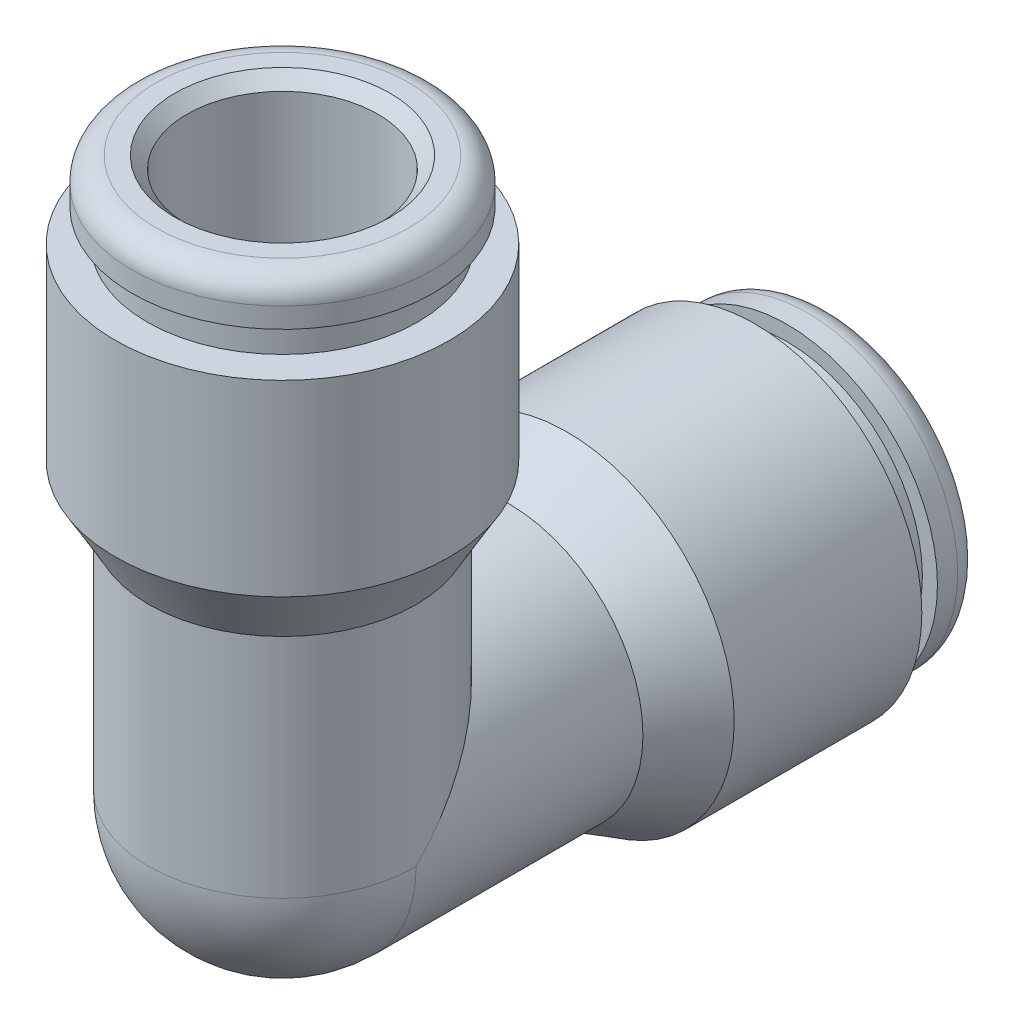
from build123d import *

# Parameters (mm, degrees)
CIRPATTERN1_COUNT = 2
CIRPATTERN1_ANGLE = 90
REVOLVE2_ANGLE    = 90
CIRPATTERN2_COUNT = 2
CIRPATTERN2_ANGLE = 90


with BuildPart() as part:
    # Sketch1 → Revolve1 (revolve)
    with BuildSketch(Plane(origin=(0, 0, 0), x_dir=(0, 0, -1), z_dir=(1, 0, 0))):
        with BuildLine():
            Line((15.853, 4.725), (16.488, 4.725))
            ThreePointArc((16.488, 4.725), (17.026815367, 4.501815367), (17.25, 3.963))
            Line((17.25, 3.963), (17.25, 3.381))
            Line((17.25, 3.381), (16.869, 3))
            Line((16.869, 3), (6, 3))
            Line((6, 3), (6, 2.238))
            Line((6, 2.238), (0, 2.238))
            Line((0, 2.238), (0, 4.2))
            Line((0, 4.2), (7.125, 4.2))
            Line((7.125, 4.2), (8.943653348, 5.25))
            Line((8.943653348, 5.25), (14.837, 5.25))
            Line((14.837, 5.25), (14.837, 4.2525))
            Line((14.837, 4.2525), (15.853, 4.2525))
            Line((15.853, 4.2525), (15.853, 4.725))
        make_face()
    revolve(axis=Axis((0, 0, 0), (0, 0, -1)))


with BuildPart() as cirpattern1_1:
    # CirPattern1: pattern copy
    add(part.part.rotate(Axis((-15.801937006, 0, 0), (1, 0, 0)), 1 * CIRPATTERN1_ANGLE / (CIRPATTERN1_COUNT - 1)))


with BuildPart() as part_1:
    add(part.part)

    # Sketch2 → Revolve2 (revolve)
    with BuildSketch(Plane.XY):
        with BuildLine():
            Line((-4.2, 0), (-2.238, 0))
            ThreePointArc((-2.238, 0), (0, -2.238), (2.238, 0))
            Line((2.238, 0), (4.2, 0))
            ThreePointArc((4.2, 0), (0, -4.2), (-4.2, 0))
        make_face()
    revolve(axis=Axis((-4.2, 0, 0), (-1, 0, 0)), revolution_arc=REVOLVE2_ANGLE)

    # Combine1: union CirPattern1_1
    add(cirpattern1_1.part)

    # Sketch3 → Cut-Revolve1 (revolve, cut)
    with BuildSketch(Plane(origin=(0, 0, 0), x_dir=(0, 0, -1), z_dir=(1, 0, 0))):
        Polygon((17.25, 3.381), (16.869, 3), (6, 3), (6, 2.238), (0, 2.238), (0, 0), (17.25, 0), align=None)
    cut_revolve1 = revolve(axis=Axis((0, 0, 0), (0, 0, -1)), mode=Mode.SUBTRACT)

    # CirPattern2: Cut-Revolve1 ×2 about axis
    cirpattern2_axis = Axis((-15.801937006, 0, 0), (1, 0, 0))
    for i in range(1, CIRPATTERN2_COUNT):
        add(cut_revolve1.rotate(cirpattern2_axis, i * CIRPATTERN2_ANGLE / (CIRPATTERN2_COUNT - 1)), mode=Mode.SUBTRACT)


solid = part_1.part
